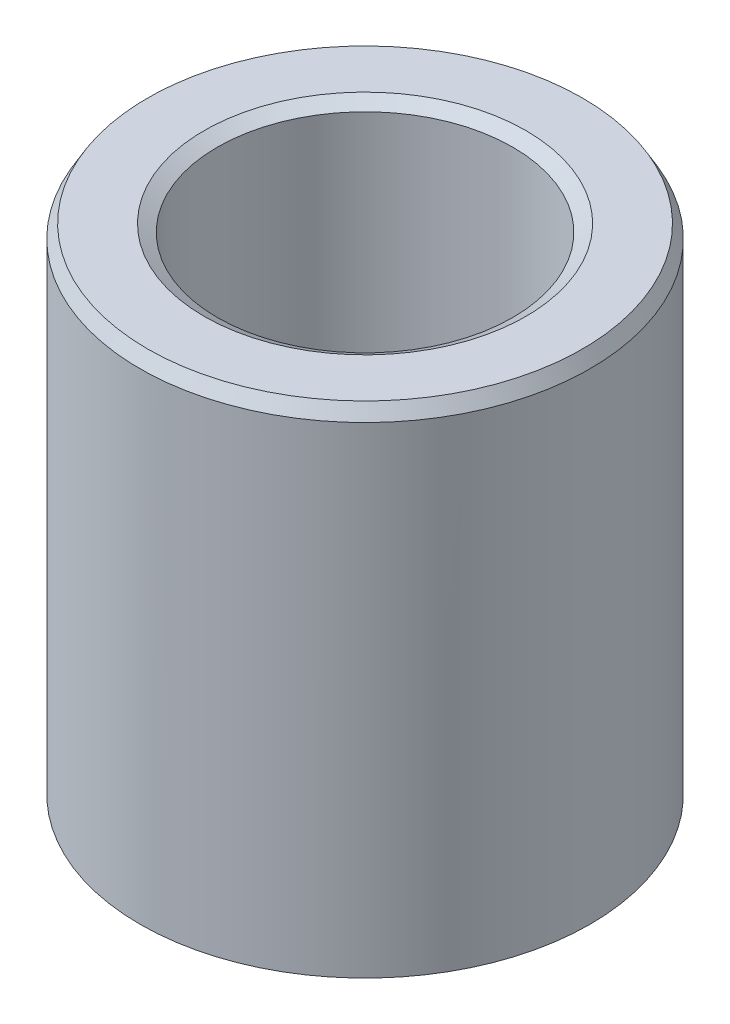
from build123d import *
from OCP.BRepFilletAPI import BRepFilletAPI_MakeChamfer

# Parameters (mm, degrees)
SKETCH1_R           = 15
BOSS_EXTRUDE1_DEPTH = 33.459743247
SKETCH2_R           = 9.840859933
CUT_EXTRUDE1_DEPTH  = 40.617602378
CHAMFER1_SIZE       = 0.884576982
CHAMFER1_SIZE2      = 0.510710759


with BuildPart() as part:
    # Sketch1 → Boss-Extrude1 (new body)
    with BuildSketch(Plane(origin=(0, 0, 0), x_dir=(1, 0, 0), z_dir=(0, 1, 0))):
        Circle(SKETCH1_R)
    extrude(amount=BOSS_EXTRUDE1_DEPTH)

    # Sketch2 → Cut-Extrude1 (cut, through all)
    with BuildSketch(Plane(origin=(0, 0, 0), x_dir=(1, 0, 0), z_dir=(0, 1, 0))):
        Circle(SKETCH2_R)
    extrude(amount=CUT_EXTRUDE1_DEPTH, mode=Mode.SUBTRACT)

    # Chamfer1: one chamfer whose edges measure the first distance from different faces: ONE call of the kernel's chamfer builder (chamfer() names one face for all edges)
    chamfer1_edges_1 = [part.edges().sort_by_distance(p)[0] for p in [
        (-9.840859933, 33.459743247, 0),
    ]]
    chamfer1_side_1 = [part.faces().sort_by_distance(p)[0] for p in [
        (-14.575735931, 33.459743247, 0),
    ]]
    chamfer1_edges_2 = [part.edges().sort_by_distance(p)[0] for p in [
        (-9.840859933, 0, 0),
    ]]
    chamfer1_side_2 = [part.faces().sort_by_distance(p)[0] for p in [
        (-9.840859933, 16.729871624, 0),
    ]]
    chamfer1_edges_3 = [part.edges().sort_by_distance(p)[0] for p in [
        (-15, 0, 0),
    ]]
    chamfer1_side_3 = [part.faces().sort_by_distance(p)[0] for p in [
        (-14.575735931, 0, 0),
    ]]
    chamfer1_edges_4 = [part.edges().sort_by_distance(p)[0] for p in [
        (-15, 33.459743247, 0),
    ]]
    chamfer1_side_4 = [part.faces().sort_by_distance(p)[0] for p in [
        (-15, 16.729871624, 0),
    ]]
    chamfer1 = BRepFilletAPI_MakeChamfer(part.part.solid().wrapped)
    for e in chamfer1_edges_1:
        chamfer1.Add(CHAMFER1_SIZE, CHAMFER1_SIZE2, e.wrapped, chamfer1_side_1[0].wrapped)  # the first distance lies on this face
    for e in chamfer1_edges_2:
        chamfer1.Add(CHAMFER1_SIZE, CHAMFER1_SIZE2, e.wrapped, chamfer1_side_2[0].wrapped)  # the first distance lies on this face
    for e in chamfer1_edges_3:
        chamfer1.Add(CHAMFER1_SIZE, CHAMFER1_SIZE2, e.wrapped, chamfer1_side_3[0].wrapped)  # the first distance lies on this face
    for e in chamfer1_edges_4:
        chamfer1.Add(CHAMFER1_SIZE, CHAMFER1_SIZE2, e.wrapped, chamfer1_side_4[0].wrapped)  # the first distance lies on this face
    add(Compound.cast(chamfer1.Shape()), mode=Mode.REPLACE)


solid = part.part
